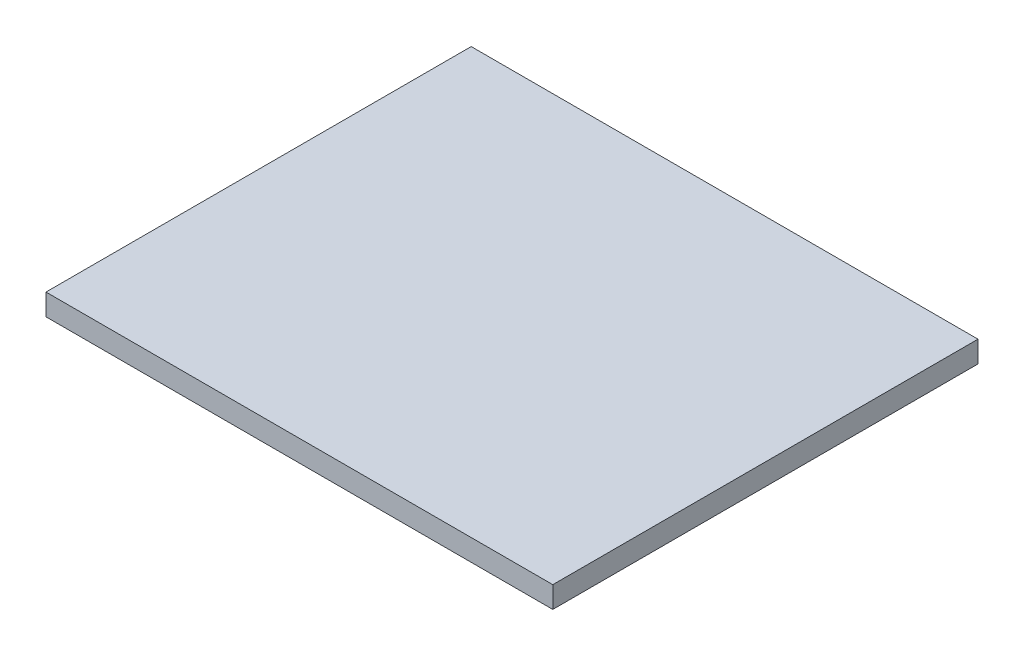
from build123d import *

# Parameters (mm, degrees)
SKETCH1_W           = 59
SKETCH1_H           = 49.5
SKETCH1_R           = 3
BOSS_EXTRUDE1_DEPTH = 1.5
BOSS_EXTRUDE2_DEPTH = 49.5
CUT_EXTRUDE1_DEPTH  = 1
CUT_EXTRUDE3_DEPTH  = 65.105869466
BOSS_EXTRUDE3_START = 0.5
SKETCH5_R           = 3
BOSS_EXTRUDE3_DEPTH = 0.5
SKETCH6_W           = 3.5
SKETCH6_H           = 2.563301414
CUT_EXTRUDE4_DEPTH  = 0.5
CHAMFER3_SIZE       = 1.5
SKETCH7_W           = 59
SKETCH7_H           = 2.086537977
CUT_EXTRUDE5_DEPTH  = 58.762444547


with BuildPart() as part:
    # Sketch1 → Boss-Extrude1 (new body)
    with BuildSketch(Plane(origin=(0, 0, 0), x_dir=(1, 0, 0), z_dir=(0, 1, 0))):
        Rectangle(SKETCH1_W, SKETCH1_H)
        with Locations(Location((0, 0, 0), (0, 0, 270))):
            Circle(SKETCH1_R, mode=Mode.SUBTRACT)
    extrude(amount=BOSS_EXTRUDE1_DEPTH)

    # Sketch2 → Boss-Extrude2 (add)
    with BuildSketch(Plane(origin=(0, 0, -24.75), x_dir=(-1, 0, 0), z_dir=(0, 0, -1))):
        Polygon((-29.5, 1.5), (29.5, 1.5), (29.5, 2.5), (28.32, 4), (27.14, 2.5), (25.96, 4), (24.78, 2.5), (23.6, 4), (22.42, 2.5), (21.24, 4), (20.06, 2.5), (18.88, 4), (17.7, 2.5), (16.52, 4), (15.34, 2.5), (14.16, 4), (12.98, 2.5), (11.8, 4), (10.62, 2.5), (9.44, 4), (8.26, 2.5), (7.08, 4), (5.9, 2.5), (4.72, 4), (3.54, 2.5), (2.36, 4), (1.18, 2.5), (0, 4), (-1.18, 2.5), (-2.36, 4), (-3.54, 2.5), (-4.72, 4), (-5.9, 2.5), (-7.08, 4), (-8.26, 2.5), (-9.44, 4), (-10.62, 2.5), (-11.8, 4), (-12.98, 2.5), (-14.16, 4), (-15.34, 2.5), (-16.52, 4), (-17.7, 2.5), (-18.88, 4), (-20.06, 2.5), (-21.24, 4), (-22.42, 2.5), (-23.6, 4), (-24.78, 2.5), (-25.96, 4), (-27.14, 2.5), (-28.32, 4), (-29.5, 2.5), align=None)
    extrude(amount=-BOSS_EXTRUDE2_DEPTH)

    # Sketch3 → Cut-Extrude1 (cut)
    with BuildSketch(Plane(origin=(0, 0, 0), x_dir=(-1, 0, 0), z_dir=(0, -1, 0))):
        with BuildLine():
            Line((-1.75, -2.436698586), (-1.75, -5))
            Line((-1.75, -5), (1.75, -5))
            Line((1.75, -5), (1.75, -2.436698586))
            ThreePointArc((1.75, -2.436698586), (0, 3), (-1.75, -2.436698586))
        make_face()
    extrude(amount=-CUT_EXTRUDE1_DEPTH, mode=Mode.SUBTRACT)

    # Sketch4 → Cut-Extrude3 (cut, through all)
    with BuildSketch(Plane(origin=(29.5, 0, 0), x_dir=(0, 0, -1), z_dir=(1, 0, 0))):
        with BuildLine():
            Line((-24, 4), (-24.75, 4))
            Line((-24.75, 4), (-24.75, 3.25))
            ThreePointArc((-24.75, 3.25), (-24.530330086, 3.780330086), (-24, 4))
        make_face()
    cut_extrude3 = extrude(amount=-CUT_EXTRUDE3_DEPTH, mode=Mode.SUBTRACT)

    # Mirror1: Cut-Extrude3 across plane
    add(cut_extrude3.mirror(Plane.XY), mode=Mode.SUBTRACT)

    # Sketch5 → Boss-Extrude3 (add)
    with BuildSketch(Plane.XZ.offset(-1.5).offset(BOSS_EXTRUDE3_START)):
        Circle(SKETCH5_R)
    extrude(amount=-BOSS_EXTRUDE3_DEPTH)

    # Sketch6 → Cut-Extrude4 (cut)
    with BuildSketch(Plane.XZ.offset(-1)):
        with Locations((0, 3.718349293)):
            Rectangle(SKETCH6_W, SKETCH6_H)
    extrude(amount=-CUT_EXTRUDE4_DEPTH, mode=Mode.SUBTRACT)

    # Chamfer3
    chamfer3_edges = [part.edges().sort_by_distance(p)[0] for p in [
        (0, 0, 5),
    ]]
    chamfer(chamfer3_edges, length=CHAMFER3_SIZE - 0.0001)  # a hair under: the kernel refuses the full size

    # Sketch7 → Cut-Extrude5 (cut, through all)
    with BuildSketch(Plane.XY.offset(24.75)):
        with Locations((0, 3.543268988)):
            Rectangle(SKETCH7_W, SKETCH7_H)
    extrude(amount=-CUT_EXTRUDE5_DEPTH, mode=Mode.SUBTRACT)


solid = part.part
